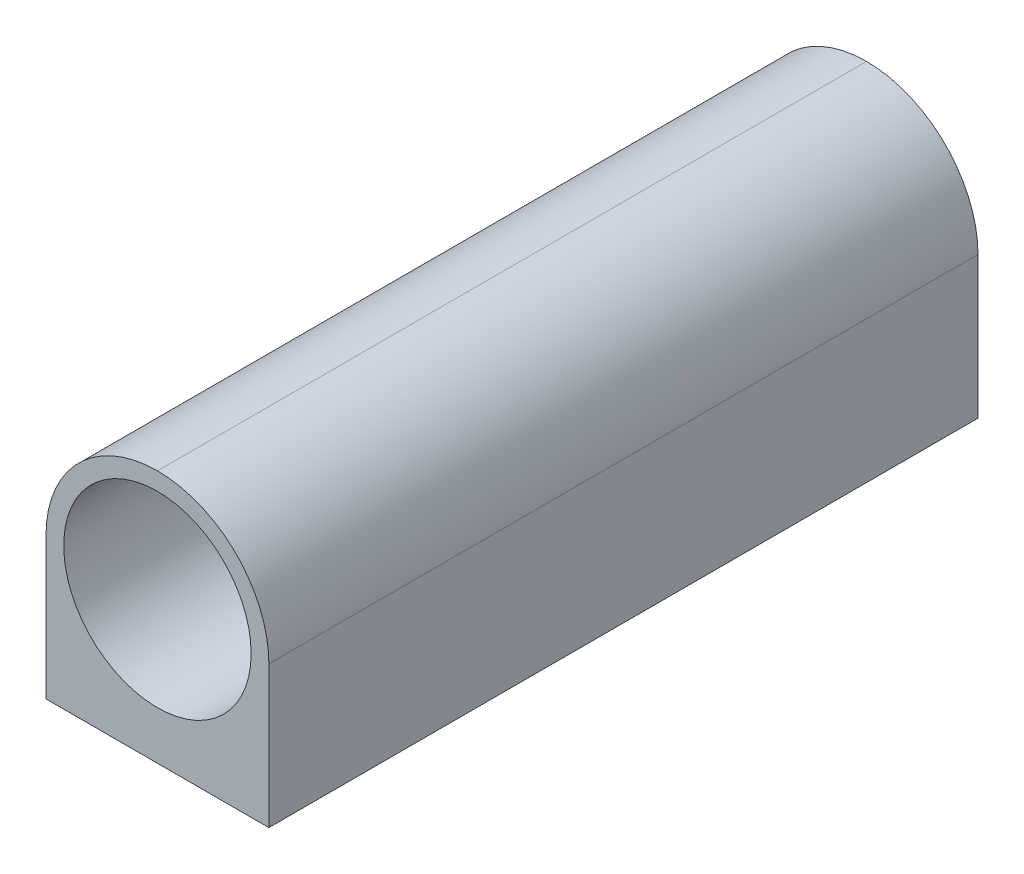
from build123d import *

# Parameters (mm, degrees)
CROQUIS1_W                = 22
CROQUIS1_H                = 22
CROQUIS1_R                = 9.25
SALIENTE_EXTRUIR1_DEPTH   = 70
REDONDEO1_R               = 11
CROQUIS6_W                = 22
CROQUIS6_H                = 70
SALIENTE_EXTRUIR2_DEPTH   = 3
TALADRO_ROSCADO_M51_D     = 4.2
TALADRO_ROSCADO_M51_DEPTH = 14
TALADRO_ROSCADO_M51_TIP   = 1.2618073


with BuildPart() as part:
    # Croquis1 → Saliente-Extruir1 (new body)
    with BuildSketch(Plane.XY):
        with Locations((11, -11)):
            Rectangle(CROQUIS1_W, CROQUIS1_H)
        with Locations((11, -11)):
            Circle(CROQUIS1_R, mode=Mode.SUBTRACT)
    extrude(amount=SALIENTE_EXTRUIR1_DEPTH)

    # Redondeo1
    redondeo1_edges = [part.edges().sort_by_distance(p)[0] for p in [
        (22, 0, 35),
        (0, 0, 35),
    ]]
    fillet(redondeo1_edges, radius=REDONDEO1_R - 0.0001)  # a hair under: the kernel refuses the full size

    # Croquis6 → Saliente-Extruir2 (add)
    with BuildSketch(Plane.XZ.offset(22)):
        with Locations((11, 35)):
            Rectangle(CROQUIS6_W, CROQUIS6_H)
    extrude(amount=SALIENTE_EXTRUIR2_DEPTH)

    # Taladro roscado M51
    with Locations(Plane(origin=(0, -25, 0), x_dir=(-1, 0, 0), z_dir=(0, -1, 0))):
        with Locations((-11, -7.622118599), (-11, -17.622118599), (-11, -27.622118599)):
            Hole(TALADRO_ROSCADO_M51_D / 2, depth=TALADRO_ROSCADO_M51_DEPTH)
            with Locations((0, 0, -(TALADRO_ROSCADO_M51_DEPTH + TALADRO_ROSCADO_M51_TIP / 2))):  # 118° drill point
                Cone(0, TALADRO_ROSCADO_M51_D / 2, TALADRO_ROSCADO_M51_TIP, mode=Mode.SUBTRACT)


solid = part.part
